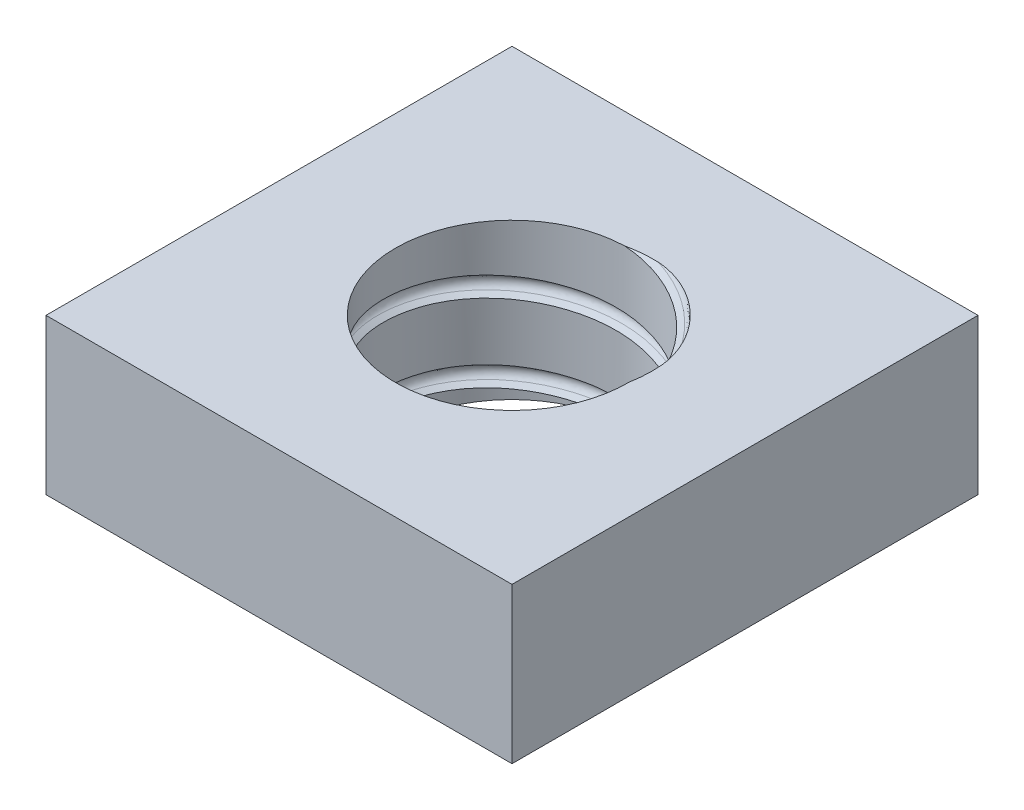
from build123d import *

# Parameters (mm, degrees)
CROQUIS1_W            = 6
CROQUIS1_H            = 6
CROQUIS1_R            = 1.5
EXTRUIR1_DEPTH        = 2
CORTAR_BARRER11_PITCH = 1


with BuildPart() as part:
    # Croquis1 → Extruir1 (new body)
    with BuildSketch(Plane(origin=(0, 0, 0), x_dir=(1, 0, 0), z_dir=(0, 1, 0))):
        Rectangle(CROQUIS1_W, CROQUIS1_H)
        with Locations(Location((0, 0, 0), (0, 0, 270))):
            Circle(CROQUIS1_R, mode=Mode.SUBTRACT)
    extrude(amount=EXTRUIR1_DEPTH)

    # Cortar-Barrer11: arcs per turn and ends read off the stored shape
    # Cortar-Barrer11: the profile of Croquis3 screwed along a right-hand helix through 9 turns, 6 arcs to a turn; built about Z, then put on its axis
    cortar_barrer11_z = Axis((0, 0, 0), (0, 0, 1))
    cortar_barrer11_corners = [(1.116538604, 1.95e-07, 0.404320764), (1.116538604, 1.95e-07, 0.396585738), (0.916538604, 1.6e-07, 0.396585738), (0.916538604, 1.6e-07, -0.403414262), (1.116538604, 1.95e-07, -0.403414262), (1.116538604, 1.95e-07, -0.411149289), (1.166538604, 2.04e-07, -0.324546749), (1.572756387, 2.74e-07, -0.090016803), (1.622756387, 2.83e-07, -0.003414262), (1.572756387, 2.74e-07, 0.083188278), (1.166538604, 2.04e-07, 0.317718224)]
    with BuildLine(mode=Mode.PRIVATE) as cortar_barrer11_profile:
        Line(cortar_barrer11_corners[0], cortar_barrer11_corners[1])
        Line(cortar_barrer11_corners[1], cortar_barrer11_corners[2])
        Line(cortar_barrer11_corners[2], cortar_barrer11_corners[3])
        Line(cortar_barrer11_corners[3], cortar_barrer11_corners[4])
        Line(cortar_barrer11_corners[4], cortar_barrer11_corners[5])
        Line(cortar_barrer11_corners[6], cortar_barrer11_corners[7])
        Line(cortar_barrer11_corners[9], cortar_barrer11_corners[10])
        ThreePointArc((1.116538604, 1.95e-07, -0.411149289), (1.129936064, 1.97e-07, -0.361149289), (1.166538604, 2.04e-07, -0.324546749))
        ThreePointArc((1.572756387, 2.74e-07, -0.090016803), (1.609358927, 2.81e-07, -0.053414262), (1.622756387, 2.83e-07, -0.003414262))
        ThreePointArc((1.622756387, 2.83e-07, -0.003414262), (1.609358927, 2.81e-07, 0.046585738), (1.572756387, 2.74e-07, 0.083188278))
        ThreePointArc((1.166538604, 2.04e-07, 0.317718224), (1.129936064, 1.97e-07, 0.354320764), (1.116538604, 1.95e-07, 0.404320764))
    cortar_barrer11_cap = Face(cortar_barrer11_profile.wire())
    cortar_barrer11_arcs = [((1.116538604, 1.95e-07, -0.411149289), (1.116538604, 1.95e-07, -0.353414262), (1.166538604, 2.04e-07, -0.324546749), (1, 0.8660254037844386, 1)), ((1.572756387, 2.74e-07, -0.090016803), (1.622756387, 2.83e-07, -0.061149289), (1.622756387, 2.83e-07, -0.003414262), (1, 0.8660254037844388, 1)), ((1.622756387, 2.83e-07, -0.003414262), (1.622756387, 2.83e-07, 0.054320764), (1.572756387, 2.74e-07, 0.083188278), (1, 0.8660254037844388, 1)), ((1.166538604, 2.04e-07, 0.317718224), (1.116538604, 1.95e-07, 0.346585738), (1.116538604, 1.95e-07, 0.404320764), (1, 0.86602540378444, 1))]  # start, shoulder, end, weights
    cortar_barrer11_turn_angles = [0, 30, 60, 90, 120, 150, 180, 210, 240, 270, 300, 330, 360]
    cortar_barrer11_turn_weights = [1, 0.8660254037844387, 1, 0.8660254037844387, 1, 0.8660254037844387, 1, 0.8660254037844387, 1, 0.8660254037844387, 1, 0.8660254037844387, 1]
    cortar_barrer11_turn_rails = [Edge.make_bspline([Vector(p[0], p[1], 0).rotate(cortar_barrer11_z, cortar_barrer11_turn_angles[k]) / cortar_barrer11_turn_weights[k] + Vector(0, 0, p[2] + CORTAR_BARRER11_PITCH * cortar_barrer11_turn_angles[k] / 360) for k in range(13)], [0, 0, 0, 1, 1, 2, 2, 3, 3, 4, 4, 5, 5, 6, 6, 6], 2, cortar_barrer11_turn_weights) for p in cortar_barrer11_corners]
    cortar_barrer11_turn_sides = [*[Face.make_surface_from_curves(cortar_barrer11_turn_rails[p[0]], cortar_barrer11_turn_rails[p[1]]) for p in [(0, 1), (1, 2), (2, 3), (3, 4), (4, 5), (6, 7), (9, 10)]], *[Face.make_bezier_surface([[Vector(p[j][0], p[j][1], 0).rotate(cortar_barrer11_z, cortar_barrer11_turn_angles[2 * i + k]) / cortar_barrer11_turn_weights[2 * i + k] + Vector(0, 0, p[j][2] + CORTAR_BARRER11_PITCH * cortar_barrer11_turn_angles[2 * i + k] / 360) for k in range(3)] for j in range(3)], [[p[3][j] * cortar_barrer11_turn_weights[2 * i + k] for k in range(3)] for j in range(3)]) for p in cortar_barrer11_arcs for i in range(6)]]
    cortar_barrer11 = Plane(origin=(0, 0, 0), x_dir=(0.7071067811865488, 0, -0.7071067811865462), z_dir=(0, 1, 0)) * Solid(Shell([*[p.moved(Location((0, 0, CORTAR_BARRER11_PITCH * i))) for i in range(9) for p in cortar_barrer11_turn_sides], cortar_barrer11_cap, cortar_barrer11_cap.rotate(cortar_barrer11_z, 3240).moved(Location((0, 0, CORTAR_BARRER11_PITCH * 3240 / 360)))]))
    add(cortar_barrer11, mode=Mode.SUBTRACT)


solid = part.part
